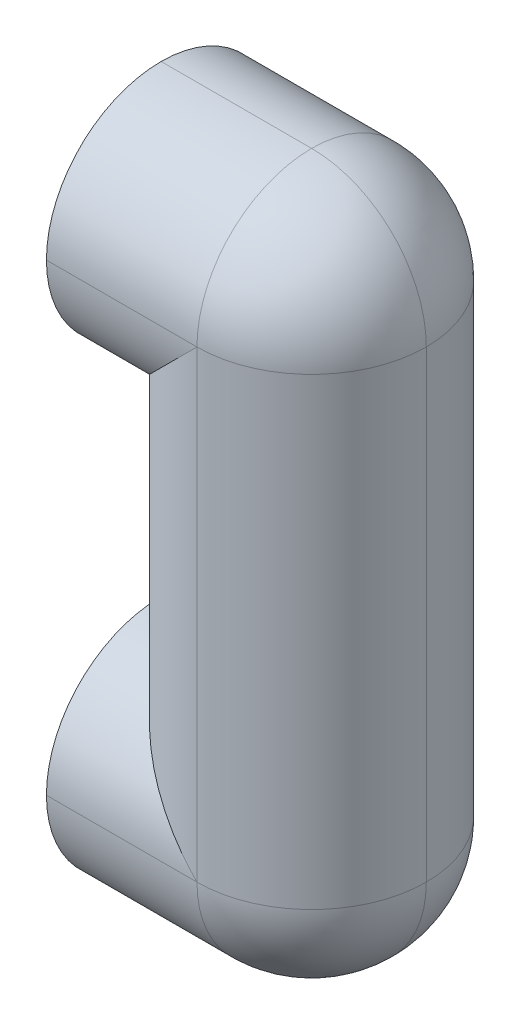
from build123d import *

# Parameters (mm, degrees)
SKETCH1_W           = 48
SKETCH1_H           = 48
BOSS_EXTRUDE1_DEPTH = 72.5
SKETCH2_W           = 48
SKETCH2_H           = 48
BOSS_EXTRUDE2_DEPTH = 7.5
FILLET1_R           = 24
SKETCH3_R           = 5
CUT_EXTRUDE1_DEPTH  = 15
SKETCH4_R           = 5
BOSS_EXTRUDE3_DEPTH = 7.5


with BuildPart() as part:
    # Sketch1 → Boss-Extrude1 (new, symmetric)
    with BuildSketch(Plane(origin=(0, 0, 0), x_dir=(1, 0, 0), z_dir=(0, 1, 0))):
        with Locations((24, 24)):
            Rectangle(SKETCH1_W, SKETCH1_H)
    extrude(amount=BOSS_EXTRUDE1_DEPTH, both=True)

    # Sketch2 → Boss-Extrude2 (add, symmetric)
    with BuildSketch(Plane.ZY):
        with Locations((-24, 48.5)):
            Rectangle(SKETCH2_W, SKETCH2_H)
        with Locations((-24, -48.5)):
            Rectangle(SKETCH2_W, SKETCH2_H)
    extrude(amount=BOSS_EXTRUDE2_DEPTH, both=True)

    # Fillet1
    fillet1_edges = [part.edges().sort_by_distance(p)[0] for p in [
        (48, 72.5, -24),
        (0, 0, -48),
        (20.25, 72.5, -48),
        (0, 0, 0),
        (-3.75, 24.5, -48),
        (-3.75, 24.5, 0),
        (-3.75, -24.5, 0),
        (-3.75, -24.5, -48),
        (20.25, -72.5, -48),
        (48, -72.5, -24),
        (20.25, -72.5, 0),
        (48, 0, -48),
        (48, 0, 0),
        (20.25, 72.5, 0),
    ]]
    fillet(fillet1_edges, radius=FILLET1_R - 0.0001)  # a hair under: the kernel refuses the full size

    # Sketch3 → Cut-Extrude1 (cut)
    with BuildSketch(Plane.ZY.offset(7.5)):
        with Locations((-24, -48.5)):
            Circle(SKETCH3_R)
    extrude(amount=-CUT_EXTRUDE1_DEPTH, mode=Mode.SUBTRACT)

    # Sketch4 → Boss-Extrude3 (add, symmetric)
    with BuildSketch(Plane.ZY.offset(7.5)):
        with Locations((-24, 48.5)):
            Circle(SKETCH4_R)
    extrude(amount=BOSS_EXTRUDE3_DEPTH, both=True)


solid = part.part
